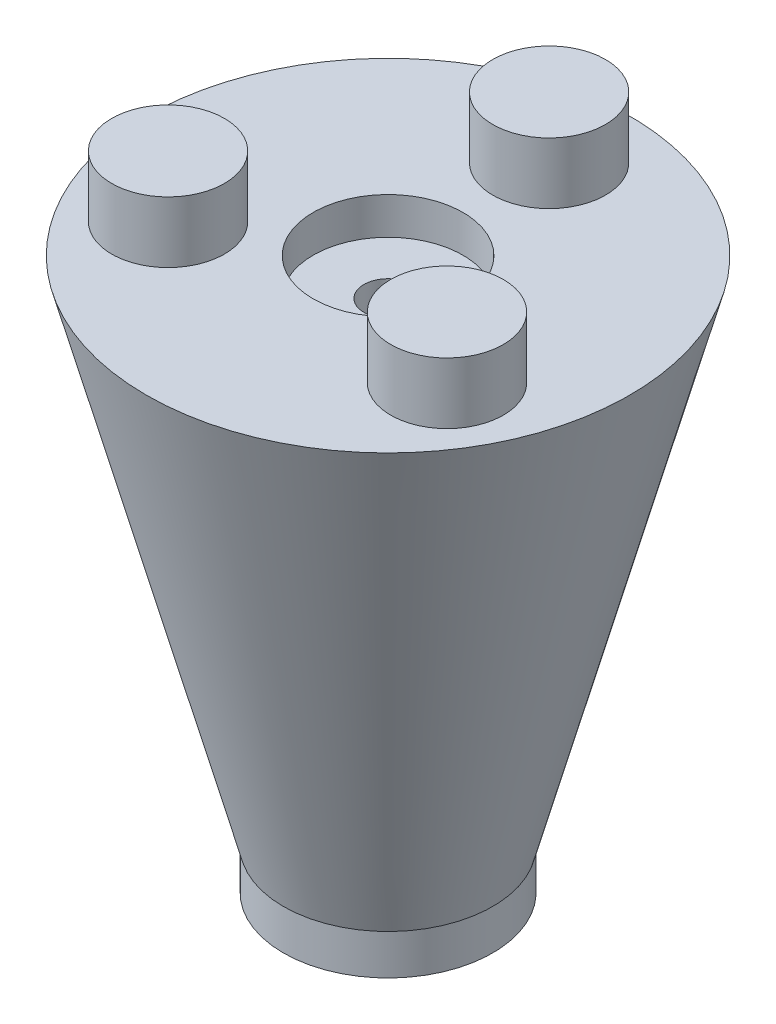
from build123d import *

# Parameters (mm, degrees)
SKETCH1_R            = 6.500000081
ANGLEBODY_DEPTH      = 31.75
ANGLEBODY_DRAFT      = -15
SKETCH2_R            = 4.649999971
SKETCH2_R_2          = 1.93499994
CENTERHOLE_DEPTH     = 39.190389178
F_40TPEGS_DEPTH      = 3.80000002
SKETCH3_R            = 6.500000081
SKETCH3_R_2          = 3.300000004
F_20TINTERFACE_DEPTH = 2.50000008
BOSS_EXTRUDE1_START  = -2.299999972
SKETCH4_R            = 4.649999971
SKETCH4_R_2          = 1.5
BOSS_EXTRUDE1_DEPTH  = 24
SKETCH5_R            = 4.649999971
SKETCH5_R_2          = 1.5
BOSS_EXTRUDE2_DEPTH  = 7.950000108


# Read off the part's stored shape, not the designer's step: Cut-Loft1
with BuildPart() as part:
    # Sketch1 → AngleBody (with draft: the straight prism first)
    with BuildSketch(Plane(origin=(0, 0, 0), x_dir=(1, 0, 0), z_dir=(0, 1, 0))):
        Circle(SKETCH1_R)
    extrude(amount=ANGLEBODY_DEPTH)
    # AngleBody: the draft: its side faces are tilted about the plane it starts from
    anglebody_sides = [part.faces().sort_by_distance(p)[0] for p in [
        (-6.500000081, 15.875, 0),
    ]]
    draft(anglebody_sides, Plane(origin=(0, 0, 0), x_dir=(1, 0, 0), z_dir=(0, 1, 0)), ANGLEBODY_DRAFT)

    # Sketch2 → CenterHole (cut, through all)
    # profile 1 of 2: a face of its own
    with BuildSketch(Plane(origin=(0, 31.75, 0), x_dir=(1, 0, 0), z_dir=(0, 1, 0))):
        with Locations(Location((0, 0, 0), (0, 0, 270))):
            Circle(SKETCH2_R)
        Circle(SKETCH2_R_2, mode=Mode.SUBTRACT)
    # profile 2 of 2: a face of its own
    with BuildSketch(Plane(origin=(0, 31.75, 0), x_dir=(1, 0, 0), z_dir=(0, 1, 0))):
        Circle(SKETCH2_R_2)
    extrude(amount=-CENTERHOLE_DEPTH, mode=Mode.SUBTRACT)

    # Sketch2<3> → 40tPegs (add)
    with BuildSketch(Plane(origin=(0, 31.75, 0), x_dir=(1, 0, 0), z_dir=(0, 1, 0))):
        with BuildLine():
            ThreePointArc((3.499999985, 10.000000066), (-1.749999993, 13.031088966), (-1.749999992, 6.968911166))
            Line((-1.749999992, 6.968911166), (0, 10.000000066))
            Line((0, 10.000000066), (1.749999992, 6.968911166))
            ThreePointArc((1.749999992, 6.968911166), (3.0310889, 8.250000073), (3.499999985, 10.000000066))
        make_face()
        with BuildLine():
            Line((0, 10.000000066), (-1.749999992, 6.968911166))
            ThreePointArc((-1.749999992, 6.968911166), (0, 6.500000081), (1.749999992, 6.968911166))
            Line((1.749999992, 6.968911166), (0, 10.000000066))
        make_face()
        with BuildLine():
            Line((-6.910254103, -1.968911133), (-8.660254095, -5.000000033))
            Line((-8.660254095, -5.000000033), (-5.16025411, -5.000000033))
            ThreePointArc((-5.16025411, -5.000000033), (-5.629165195, -3.25000004), (-6.910254103, -1.968911133))
        make_face()
        with BuildLine():
            Line((-5.16025411, -5.000000033), (-8.660254095, -5.000000033))
            Line((-8.660254095, -5.000000033), (-6.910254103, -1.968911133))
            ThreePointArc((-6.910254103, -1.968911133), (-11.691342995, -6.750000026), (-5.16025411, -5.000000033))
        make_face()
        with BuildLine():
            ThreePointArc((6.910254103, -1.968911133), (5.629165195, -3.25000004), (5.16025411, -5.000000033))
            Line((5.16025411, -5.000000033), (8.660254095, -5.000000033))
            Line((8.660254095, -5.000000033), (6.910254103, -1.968911133))
        make_face()
        with BuildLine():
            Line((8.660254095, -5.000000033), (5.16025411, -5.000000033))
            ThreePointArc((5.16025411, -5.000000033), (8.660254095, -8.500000018), (12.16025408, -5.000000033))
            ThreePointArc((12.16025408, -5.000000033), (10.410254088, -1.968911133), (6.910254103, -1.968911133))
            Line((6.910254103, -1.968911133), (8.660254095, -5.000000033))
        make_face()
    extrude(amount=F_40TPEGS_DEPTH)

    # Sketch3 → 20tInterface (add)
    with BuildSketch(Plane.XZ):
        with Locations(Location((0, 0, 0), (0, 0, 270))):
            Circle(SKETCH3_R)
        with Locations(Location((0, 0, 0), (0, 0, 270))):
            Circle(SKETCH3_R_2, mode=Mode.SUBTRACT)
    extrude(amount=F_20TINTERFACE_DEPTH)

    # Sketch4 → Boss-Extrude1 (add)
    with BuildSketch(Plane(origin=(0, 31.75, 0), x_dir=(1, 0, 0), z_dir=(0, 1, 0)).offset(BOSS_EXTRUDE1_START)):
        with Locations(Location((0, 0, 0), (0, 0, 270))):
            Circle(SKETCH4_R)
        with Locations(Location((0, 0, 0), (0, 0, 270))):
            Circle(SKETCH4_R_2, mode=Mode.SUBTRACT)
    extrude(amount=-BOSS_EXTRUDE1_DEPTH)


with BuildPart() as body_2:
    # Sketch5 → Boss-Extrude2 (new body)
    with BuildSketch(Plane.XZ.offset(-5.450000028)):
        with Locations(Location((0, 0, 0), (0, 0, 270))):
            Circle(SKETCH5_R)
        with Locations(Location((0, 0, 0), (0, 0, 270))):
            Circle(SKETCH5_R_2, mode=Mode.SUBTRACT)
    extrude(amount=BOSS_EXTRUDE2_DEPTH)

    # Cut-Loft1 outline → Cut-Loft1 (revolve, cut)
    with BuildSketch(Plane.XY):
        Polygon((3.300000004, -2.50000008), (1.5, 5.450000028), (1.5, -2.50000008), align=None)
    revolve(axis=Axis((0, 0, 0), (0, 1, 0)), mode=Mode.SUBTRACT)


solid = Compound([part.part, body_2.part])
